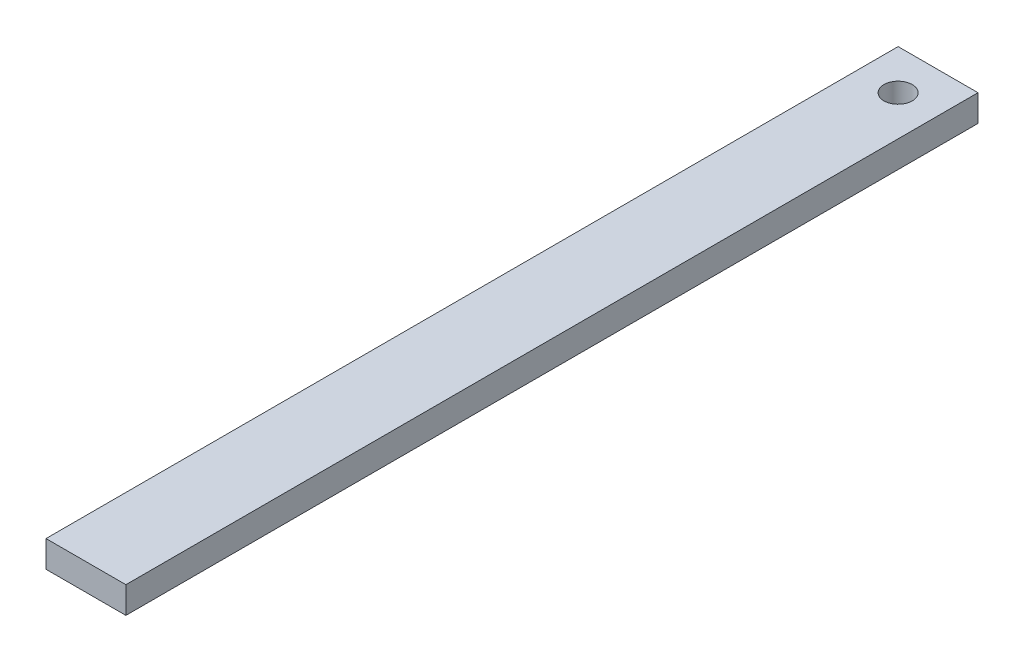
from build123d import *

# Parameters (mm, degrees)
SKETCH1_W               = 19.05
SKETCH1_H               = 6.35
BOSS_EXTRUDE1_DEPTH     = 203.2
F_1_4_CLEARANCE_HOLE1_D = 6.7564


with BuildPart() as part:
    # Sketch1 → Boss-Extrude1 (new body)
    with BuildSketch(Plane.XY):
        Rectangle(SKETCH1_W, SKETCH1_H)
    extrude(amount=BOSS_EXTRUDE1_DEPTH)

    # 1/4 Clearance Hole1 (through all)
    with Locations(Plane(origin=(0, 3.175, 0), x_dir=(1, 0, 0), z_dir=(0, 1, 0))):
        with Locations((0, -9.525)):
            Hole(F_1_4_CLEARANCE_HOLE1_D / 2)


solid = part.part
